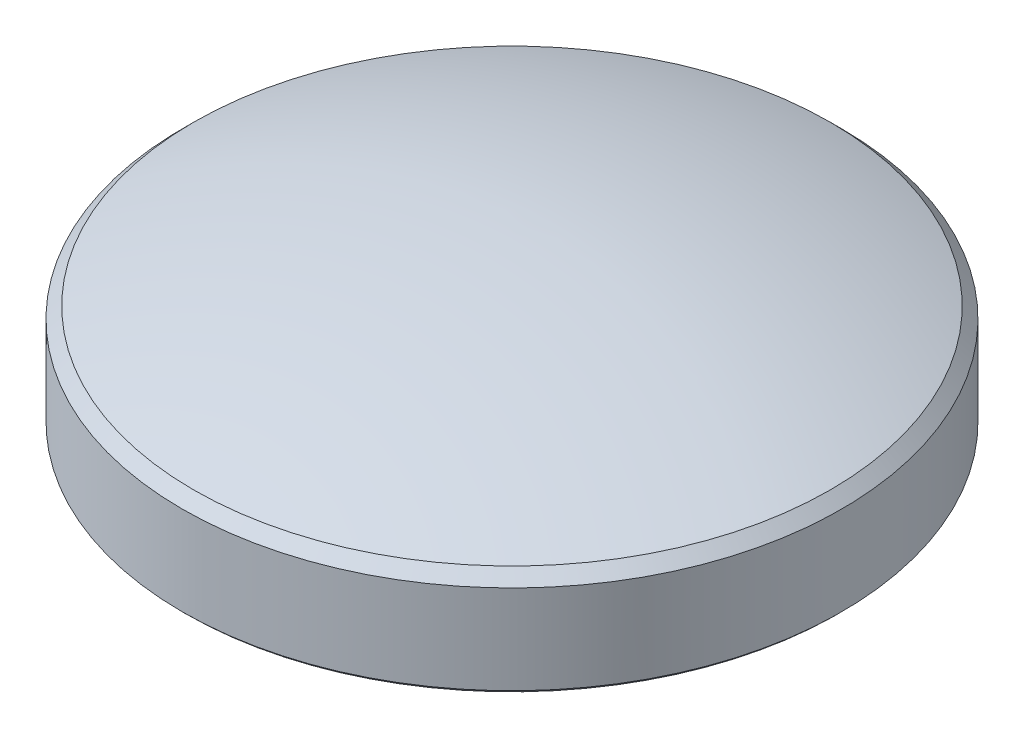
from build123d import *

# Parameters (mm, degrees)
CHAMFER2_SIZE      = 0.254
CHAMFER3_SIZE      = 0.508
SKETCH4_R          = 1.89865
CUT_EXTRUDE1_DEPTH = 5.08


with BuildPart() as part:
    # Sketch1 → Revolve1 (revolve)
    with BuildSketch(Plane.XY, mode=Mode.PRIVATE) as revolve1_sk:
        with BuildLine():
            Line((0, 5.55625), (4.365625, 5.55625))
            Line((4.365625, 5.55625), (4.365625, 0))
            Line((4.365625, 0), (13.17625, 0))
            Line((13.17625, 0), (15.24, -2.06375))
            Line((15.24, -2.06375), (25.4, -2.06375))
            Line((25.4, -2.06375), (25.4, 5.55625))
            ThreePointArc((25.4, 5.55625), (12.951509565, 9.353797823), (0, 10.63625))
            Line((0, 10.63625), (0, 5.55625))
        make_face()
    revolve(revolve1_sk.sketch.rotate(Axis((0, 18.150046132, 0), (0, -1, 0)), 90), axis=Axis((0, 18.150046132, 0), (0, -1, 0)))

    # Chamfer2
    chamfer2_edges = [part.edges().sort_by_distance(p)[0] for p in [
        (0, -2.06375, -25.4),
    ]]
    chamfer(chamfer2_edges, length=CHAMFER2_SIZE)

    # Chamfer3
    # the kernel refuses this chamfer: 0.943428571, 0.508 mm, written as the material it takes off along each edge
    with BuildSketch(Plane(origin=(0, 5.55625, 0), x_dir=(0, 0, 1), z_dir=(1, 0, 0))) as chamfer3_piece_1:
        with BuildLine():
            Line((25.4, CHAMFER3_SIZE), (24.541242074, -0.350757926))
            ThreePointArc((24.541242074, -0.350757926), (24.955132553, -0.183462114), (25.4, 0))
            Line((25.4, 0), (25.4, CHAMFER3_SIZE))
        make_face()
    revolve(axis=Axis((0, 5.55625, 0), (0, -1, 0)), mode=Mode.SUBTRACT)

    # Sketch4 → Cut-Extrude1 (cut)
    with BuildSketch(Plane.XZ.offset(2.06375)):
        with Locations(Location((19.05, 0, 0), (0, 0, 270))):
            Circle(SKETCH4_R)
        with Locations(Location((-9.525, 16.497783942, 0), (0, 0, 270))):
            Circle(SKETCH4_R)
        with Locations(Location((-9.525, -16.497783942, 0), (0, 0, 90))):
            Circle(SKETCH4_R)
    extrude(amount=-CUT_EXTRUDE1_DEPTH, mode=Mode.SUBTRACT)


solid = part.part
